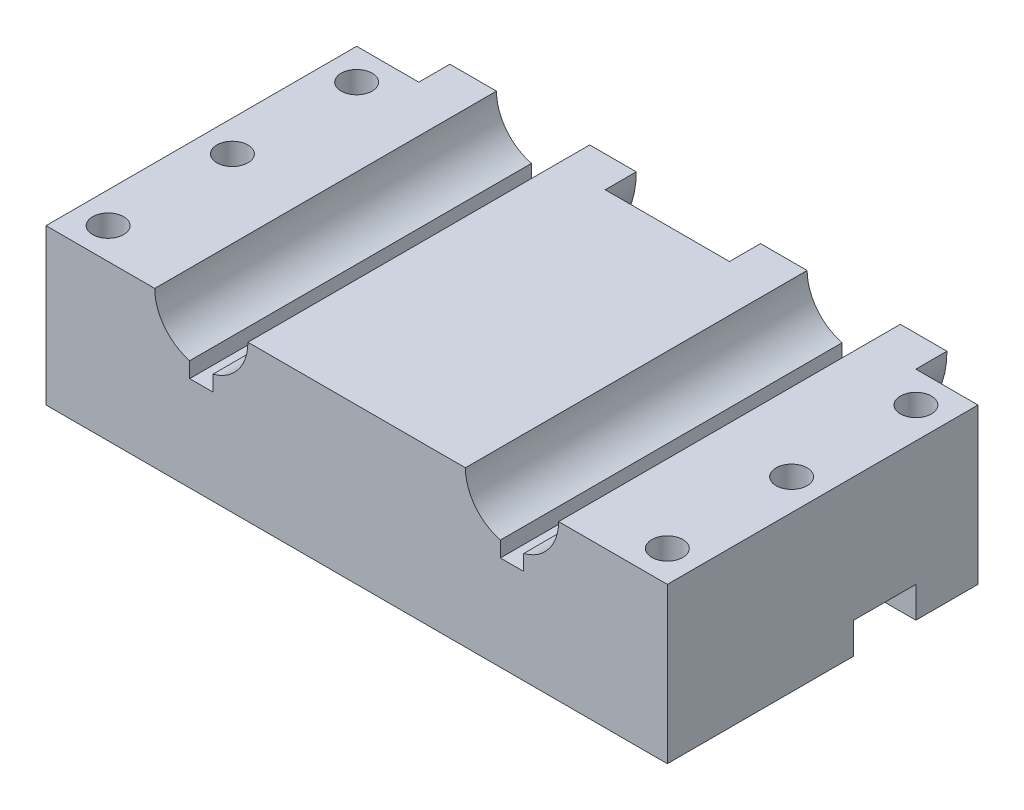
from build123d import *

# Parameters (mm, degrees)
SKETCH1_W           = 254
SKETCH1_H           = 127
SKETCH1_R           = 6.35
BOSS_EXTRUDE3_DEPTH = 63.5
CUT_EXTRUDE1_DEPTH  = 291.99355663
BOSS_EXTRUDE4_DEPTH = 12.7
CUT_EXTRUDE4_DEPTH  = 291.99355663


with BuildPart() as part:
    # Sketch1 → Boss-Extrude3 (new body)
    with BuildSketch(Plane(origin=(0, 0, 0), x_dir=(1, 0, 0), z_dir=(0, 1, 0))):
        with Locations((127, -63.5)):
            Rectangle(SKETCH1_W, SKETCH1_H)
        with Locations((12.7, -114.3)):
            Circle(SKETCH1_R, mode=Mode.SUBTRACT)
        with Locations((241.3, -114.3)):
            Circle(SKETCH1_R, mode=Mode.SUBTRACT)
        with Locations((12.7, -63.5)):
            Circle(SKETCH1_R, mode=Mode.SUBTRACT)
        with Locations((12.7, -12.7)):
            Circle(SKETCH1_R, mode=Mode.SUBTRACT)
        with Locations((241.3, -63.5)):
            Circle(SKETCH1_R, mode=Mode.SUBTRACT)
        with Locations((241.3, -12.7)):
            Circle(SKETCH1_R, mode=Mode.SUBTRACT)
    extrude(amount=BOSS_EXTRUDE3_DEPTH)

    # Sketch2 → Cut-Extrude1 (cut, through all)
    with BuildSketch(Plane(origin=(254, 0, 0), x_dir=(0, 0, -1), z_dir=(1, 0, 0))):
        Polygon((-25.4, -249.623120754), (-25.4, 0), (-25.4, 12.7), (-50.8, 12.7), (-50.8, 0), (-50.8, -249.623120754), (-50.8, -748.869362263), (-25.4, -748.869362263), align=None)
    extrude(amount=-CUT_EXTRUDE1_DEPTH, mode=Mode.SUBTRACT)

    # Sketch3 → Boss-Extrude4 (add)
    with BuildSketch(Plane(origin=(0, 0, 0), x_dir=(-1, 0, 0), z_dir=(0, 0, -1))):
        with BuildLine():
            ThreePointArc((-44.45, 63.5), (-48.439652643, 51.8343051), (-58.7375, 45.054916814))
            Line((-58.7375, 45.054916814), (-58.7375, 38.704916814))
            Line((-58.7375, 38.704916814), (-68.2625, 38.704916814))
            Line((-68.2625, 38.704916814), (-68.2625, 45.054916814))
            ThreePointArc((-68.2625, 45.054916814), (-78.560347357, 51.8343051), (-82.55, 63.5))
            Line((-82.55, 63.5), (-101.6, 63.5))
            ThreePointArc((-101.6, 63.5), (-63.5, 25.4), (-25.4, 63.5))
            Line((-25.4, 63.5), (-44.45, 63.5))
        make_face()
        with BuildLine():
            ThreePointArc((-228.6, 63.5), (-190.5, 25.4), (-152.4, 63.5))
            Line((-152.4, 63.5), (-171.45, 63.5))
            ThreePointArc((-171.45, 63.5), (-175.439652643, 51.8343051), (-185.7375, 45.054916814))
            Line((-185.7375, 45.054916814), (-185.7375, 38.704916814))
            Line((-185.7375, 38.704916814), (-195.2625, 38.704916814))
            Line((-195.2625, 38.704916814), (-195.2625, 45.054916814))
            ThreePointArc((-195.2625, 45.054916814), (-205.560347357, 51.8343051), (-209.55, 63.5))
            Line((-209.55, 63.5), (-228.6, 63.5))
        make_face()
    extrude(amount=BOSS_EXTRUDE4_DEPTH)

    # Sketch3<5> → Cut-Extrude4 (cut, through all)
    with BuildSketch(Plane(origin=(0, 0, 0), x_dir=(-1, 0, 0), z_dir=(0, 0, -1))):
        with BuildLine():
            ThreePointArc((-82.55, 63.5), (-78.560347357, 51.8343051), (-68.2625, 45.054916814))
            Line((-68.2625, 45.054916814), (-68.2625, 38.704916814))
            Line((-68.2625, 38.704916814), (-58.7375, 38.704916814))
            Line((-58.7375, 38.704916814), (-58.7375, 45.054916814))
            ThreePointArc((-58.7375, 45.054916814), (-48.439652643, 51.8343051), (-44.45, 63.5))
            Line((-44.45, 63.5), (-82.55, 63.5))
        make_face()
        with BuildLine():
            ThreePointArc((-185.7375, 45.054916814), (-175.439652643, 51.8343051), (-171.45, 63.5))
            Line((-171.45, 63.5), (-209.55, 63.5))
            ThreePointArc((-209.55, 63.5), (-205.560347357, 51.8343051), (-195.2625, 45.054916814))
            Line((-195.2625, 45.054916814), (-195.2625, 38.704916814))
            Line((-195.2625, 38.704916814), (-185.7375, 38.704916814))
            Line((-185.7375, 38.704916814), (-185.7375, 45.054916814))
        make_face()
    extrude(amount=-CUT_EXTRUDE4_DEPTH, mode=Mode.SUBTRACT)


solid = part.part
